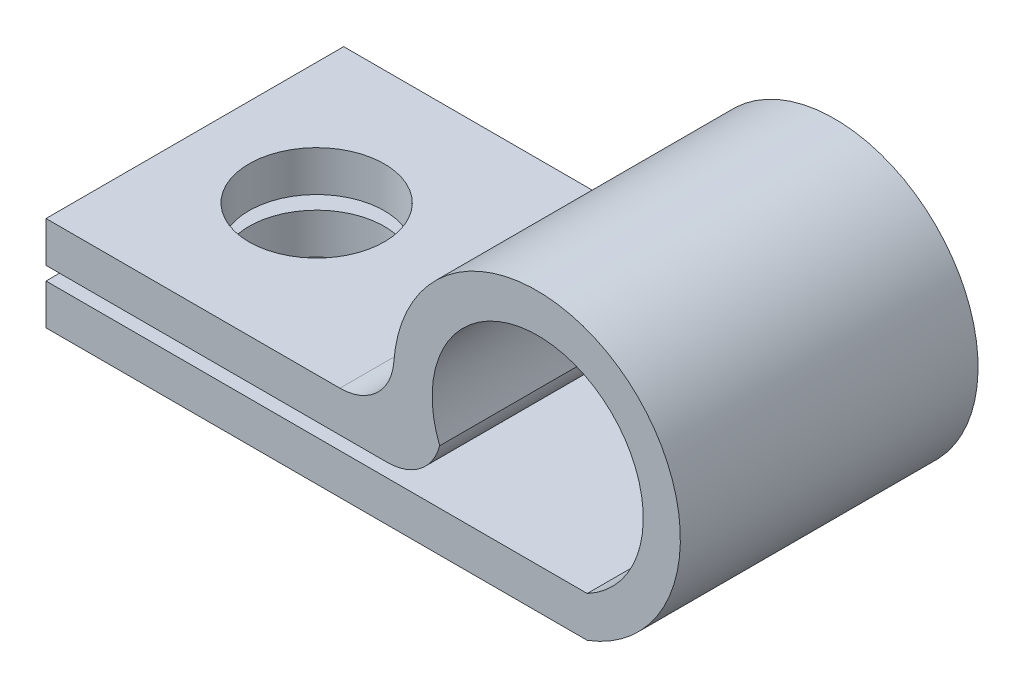
from build123d import *

# Parameters (mm, degrees)
SKETCH1_W           = 14.546192004
SKETCH1_H           = 1.5
SKETCH1_W_2         = 20
BOSS_EXTRUDE1_DEPTH = 11
SKETCH2_R           = 2.5
CUT_EXTRUDE1_DEPTH  = 26.026570584
FILLET1_R           = 2
FILLET2_R           = 2


with BuildPart() as part:
    # Sketch1 → Boss-Extrude1 (new body)
    with BuildSketch(Plane.XY):
        with Locations((-12.726903998, 2.75)):
            Rectangle(SKETCH1_W, SKETCH1_H)
        with BuildLine():
            Line((0, 1.5), (0, 0))
            ThreePointArc((0, 0), (0.523071842, 9.697161138), (-6.953807996, 3.5))
            Line((-6.953807996, 3.5), (-5.453807996, 3.5))
            ThreePointArc((-5.453807996, 3.5), (-0.488055957, 8.605123673), (0, 1.5))
        make_face()
        with Locations((-10, 0.75)):
            Rectangle(SKETCH1_W_2, SKETCH1_H)
    extrude(amount=BOSS_EXTRUDE1_DEPTH)

    # Sketch2 → Cut-Extrude1 (cut, through all)
    with BuildSketch(Plane(origin=(0, 0, 0), x_dir=(-1, 0, 0), z_dir=(0, -1, 0))):
        with Locations(Location((15.5, -5.5, 0), (0, 0, 270))):
            Circle(SKETCH2_R)
    extrude(amount=-CUT_EXTRUDE1_DEPTH, mode=Mode.SUBTRACT)

    # Fillet1
    fillet1_edges = [part.edges().sort_by_distance(p)[0] for p in [
        (-6.953807996, 3.5, 5.5),
    ]]
    fillet(fillet1_edges, radius=FILLET1_R)

    # Fillet2
    # the kernel refuses this fillet: 2 mm, written as the material it takes off along each edge
    with BuildSketch(Plane(origin=(-5.453807996, 2, -4.841229183), x_dir=(-1, 0, 0), z_dir=(0, 0, 1))) as fillet2_piece_1:
        with BuildLine():
            CenterArc((1.936491673, -2), FILLET2_R, 90, 75.522487814)
            Line((0, -1.5), (-0.038729833, -1.49))
            ThreePointArc((-0.038729833, -1.49), (-0.04, -0.75), (-0.04, 0))
            Line((-0.04, 0), (0, 0.04))
            Line((0, 0.04), (1.936491673, 0.04))
            Line((1.936491673, 0.04), (1.936491673, 0))
        make_face()
    extrude(amount=20.682458366, mode=Mode.SUBTRACT)


solid = part.part
